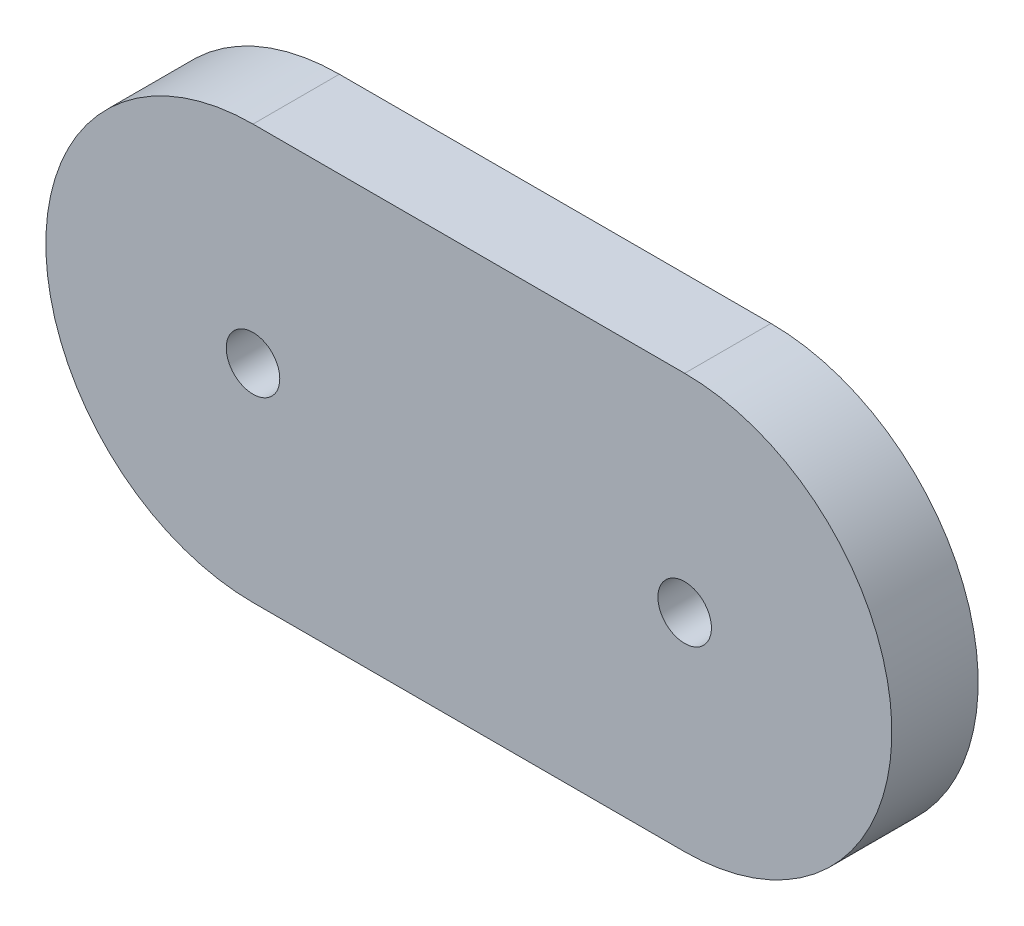
from build123d import *

# Parameters (mm, degrees)
EXTRUDE_1_DEPTH     = 5
SKETCH_2_R          = 1.55
CUT_EXTRUDE_1_DEPTH = 12


with BuildPart() as part:
    # 草图1 → 凸台-拉伸1 (new body)
    with BuildSketch(Plane.XY):
        with BuildLine():
            Line((0, 12), (25, 12))
            ThreePointArc((25, 12), (37, 0), (25, -12))
            Line((25, -12), (0, -12))
            ThreePointArc((0, -12), (-12, 0), (0, 12))
        make_face()
    extrude(amount=EXTRUDE_1_DEPTH)

    # 草图2 → 切除-拉伸1 (cut)
    with BuildSketch(Plane(origin=(0, 0, 0), x_dir=(-1, 0, 0), z_dir=(0, 0, -1))):
        Circle(SKETCH_2_R)
        with Locations((-25, 0)):
            Circle(SKETCH_2_R)
    extrude(amount=-CUT_EXTRUDE_1_DEPTH, mode=Mode.SUBTRACT)


solid = part.part
